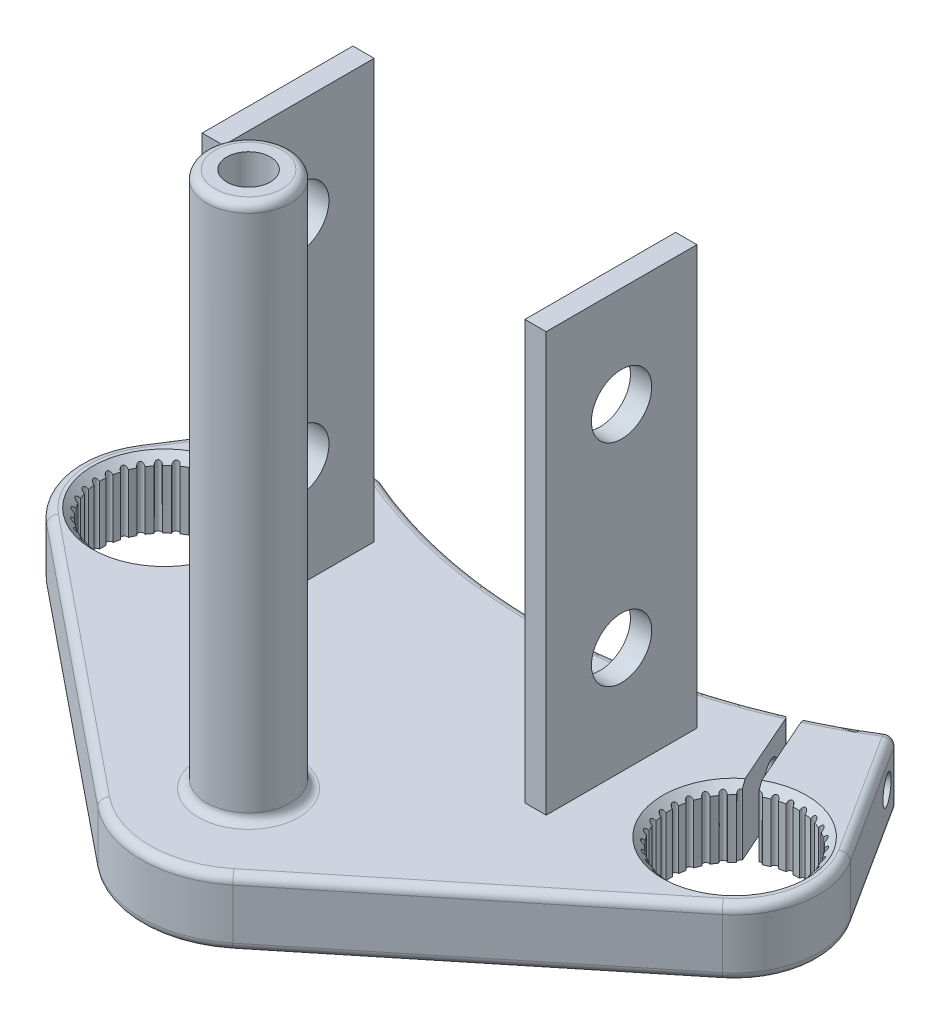
from build123d import *

# Parameters (mm, degrees)
BOSS_EXTRUDE1_DEPTH      = 20
SKETCH2_R                = 12.5
BOSS_EXTRUDE2_DEPTH      = 160
SKETCH3_W                = 6.35
SKETCH3_H                = 45
BOSS_EXTRUDE3_DEPTH      = 125
HOLE1_START              = 155
HOLE1_OUTLINE_R          = 6.5
HOLE1_DEPTH              = 25
SKETCH5_R                = 4
CUT_EXTRUDE1_DEPTH       = 32
CHAMFER1_SIZE            = 2.5
SKETCH6_R                = 0.9
CUT_EXTRUDE2_DEPTH       = 215.909306453
CIRPATTERN1_COUNT        = 32
MIRROR2_COPY_1_SKETCH_R  = 0.9
MIRROR2_COPY_1_DEPTH     = 215.909306453
MIRROR2_COPY_2_SKETCH_R  = 0.9
MIRROR2_COPY_2_DEPTH     = 215.909306453
MIRROR2_COPY_3_SKETCH_R  = 0.9
MIRROR2_COPY_3_DEPTH     = 215.909306453
MIRROR2_COPY_4_SKETCH_R  = 0.9
MIRROR2_COPY_4_DEPTH     = 215.909306453
MIRROR2_COPY_5_SKETCH_R  = 0.9
MIRROR2_COPY_5_DEPTH     = 215.909306453
MIRROR2_COPY_6_SKETCH_R  = 0.9
MIRROR2_COPY_6_DEPTH     = 215.909306453
MIRROR2_COPY_7_SKETCH_R  = 0.9
MIRROR2_COPY_7_DEPTH     = 215.909306453
MIRROR2_COPY_8_SKETCH_R  = 0.9
MIRROR2_COPY_8_DEPTH     = 215.909306453
MIRROR2_COPY_9_SKETCH_R  = 0.9
MIRROR2_COPY_9_DEPTH     = 215.909306453
MIRROR2_COPY_10_SKETCH_R = 0.9
MIRROR2_COPY_10_DEPTH    = 215.909306453
MIRROR2_COPY_11_SKETCH_R = 0.9
MIRROR2_COPY_11_DEPTH    = 215.909306453
MIRROR2_COPY_12_SKETCH_R = 0.9
MIRROR2_COPY_12_DEPTH    = 215.909306453
MIRROR2_COPY_13_SKETCH_R = 0.9
MIRROR2_COPY_13_DEPTH    = 215.909306453
MIRROR2_COPY_14_SKETCH_R = 0.9
MIRROR2_COPY_14_DEPTH    = 215.909306453
MIRROR2_COPY_15_SKETCH_R = 0.9
MIRROR2_COPY_15_DEPTH    = 215.909306453
MIRROR2_COPY_16_SKETCH_R = 0.9
MIRROR2_COPY_16_DEPTH    = 215.909306453
MIRROR2_COPY_17_SKETCH_R = 0.9
MIRROR2_COPY_17_DEPTH    = 215.909306453
MIRROR2_COPY_18_SKETCH_R = 0.9
MIRROR2_COPY_18_DEPTH    = 215.909306453
MIRROR2_COPY_19_SKETCH_R = 0.9
MIRROR2_COPY_19_DEPTH    = 215.909306453
MIRROR2_COPY_20_SKETCH_R = 0.9
MIRROR2_COPY_20_DEPTH    = 215.909306453
MIRROR2_COPY_21_SKETCH_R = 0.9
MIRROR2_COPY_21_DEPTH    = 215.909306453
MIRROR2_COPY_22_SKETCH_R = 0.9
MIRROR2_COPY_22_DEPTH    = 215.909306453
MIRROR2_COPY_23_SKETCH_R = 0.9
MIRROR2_COPY_23_DEPTH    = 215.909306453
MIRROR2_COPY_24_SKETCH_R = 0.9
MIRROR2_COPY_24_DEPTH    = 215.909306453
MIRROR2_COPY_25_SKETCH_R = 0.9
MIRROR2_COPY_25_DEPTH    = 215.909306453
MIRROR2_COPY_26_SKETCH_R = 0.9
MIRROR2_COPY_26_DEPTH    = 215.909306453
MIRROR2_COPY_27_SKETCH_R = 0.9
MIRROR2_COPY_27_DEPTH    = 215.909306453
MIRROR2_COPY_28_SKETCH_R = 0.9
MIRROR2_COPY_28_DEPTH    = 215.909306453
MIRROR2_COPY_29_SKETCH_R = 0.9
MIRROR2_COPY_29_DEPTH    = 215.909306453
MIRROR2_COPY_30_SKETCH_R = 0.9
MIRROR2_COPY_30_DEPTH    = 215.909306453
MIRROR2_COPY_31_SKETCH_R = 0.9
MIRROR2_COPY_31_DEPTH    = 215.909306453
SKETCH7_R                = 9
CUT_EXTRUDE3_DEPTH       = 259.708528077
FILLET1_R                = 2.5


# Read off the part's stored shape, not the designer's step: Hole1
with BuildPart() as part:
    # Sketch1 → Boss-Extrude1 (new body)
    with BuildSketch(Plane(origin=(0, 0, 0), x_dir=(1, 0, 0), z_dir=(0, 1, 0))):
        with BuildLine():
            Line((-81.870927934, 51.465613147), (-106.163647893, 13.465613147))
            ThreePointArc((-106.163647893, 13.465613147), (-109.779474459, -3.990431109), (-100.846768223, -19.417499596))
            Line((-100.846768223, -19.417499596), (-20.155863325, -84.854399482))
            ThreePointArc((-20.155863325, -84.854399482), (0, -92), (20.155863325, -84.854399482))
            Line((20.155863325, -84.854399482), (100.846768223, -19.417499596))
            ThreePointArc((100.846768223, -19.417499596), (109.779474459, -3.990431109), (106.163647893, 13.465613147))
            Line((106.163647893, 13.465613147), (81.870927934, 51.465613147))
            ThreePointArc((81.870927934, 51.465613147), (73.268097521, 46.356821698), (64.347800218, 41.825074))
            Line((64.347800218, 41.825074), (75.519238285, 16.407589858))
            ThreePointArc((75.519238285, 16.407589858), (96.182851462, -15.432770441), (72.613501115, 14.320870979))
            Line((72.613501115, 14.320870979), (61.160054614, 40.379986471))
            ThreePointArc((61.160054614, 40.379986471), (0, 27.532592338), (-61.160054614, 40.379986471))
            Line((-61.160054614, 40.379986471), (-72.613501115, 14.320870979))
            ThreePointArc((-72.613501115, 14.320870979), (-96.182851462, -15.432770441), (-75.519238285, 16.407589858))
            Line((-75.519238285, 16.407589858), (-64.347800218, 41.825074))
            ThreePointArc((-64.347800218, 41.825074), (-73.268097521, 46.356821698), (-81.870927934, 51.465613147))
        make_face()
    extrude(amount=BOSS_EXTRUDE1_DEPTH)

    # Sketch2 → Boss-Extrude2 (add)
    with BuildSketch(Plane(origin=(0, 20, 0), x_dir=(1, 0, 0), z_dir=(0, 1, 0))):
        with Locations(Location((0, -60, 0), (0, 0, 90))):
            Circle(SKETCH2_R)
    extrude(amount=BOSS_EXTRUDE2_DEPTH)

    # Sketch3 → Boss-Extrude3 (add)
    with BuildSketch(Plane(origin=(0, 20, 0), x_dir=(1, 0, 0), z_dir=(0, 1, 0))):
        with Locations((48.175, 0)):
            Rectangle(SKETCH3_W, SKETCH3_H)
        with Locations((-48.175, 0)):
            Rectangle(SKETCH3_W, SKETCH3_H)
    extrude(amount=BOSS_EXTRUDE3_DEPTH)

    # Hole1 outline → Hole1 (cut)
    with BuildSketch(Plane(origin=(0, 0, 0), x_dir=(1, 0, 0), z_dir=(0, 1, 0)).offset(HOLE1_START)):
        with Locations((0, -60)):
            Circle(HOLE1_OUTLINE_R)
    extrude(amount=HOLE1_DEPTH, mode=Mode.SUBTRACT)

    # Sketch5 → Cut-Extrude1 (cut)
    with BuildSketch(Plane(origin=(81.474743965, 0, -52.08534576), x_dir=(-0.5386245258830547, 0, -0.8425459157323444), z_dir=(0.8425459157323443, 0, -0.5386245258830545))):
        with Locations((-9.735547584, 11)):
            Circle(SKETCH5_R)
    cut_extrude1 = extrude(amount=-CUT_EXTRUDE1_DEPTH, mode=Mode.SUBTRACT)

    # Mirror1: Cut-Extrude1 across plane
    add(cut_extrude1.mirror(Plane(origin=(0, 0, 0), x_dir=(0, 0, 1), z_dir=(1, 0, 0))), mode=Mode.SUBTRACT)

    # Chamfer1
    chamfer1_edges = [part.edges().sort_by_distance(p)[0] for p in [
        (-96.182851462, 20, 15.432770441),
        (96.182851462, 20, 15.432770441),
    ]]
    chamfer(chamfer1_edges, length=CHAMFER1_SIZE)

    # Sketch6 → Cut-Extrude2 (cut, through all)
    with BuildSketch(Plane(origin=(0, 20, 0), x_dir=(1, 0, 0), z_dir=(0, 1, 0))):
        with Locations((72.613501115, 14.320870979)):
            Circle(SKETCH6_R)
    cut_extrude2 = extrude(amount=-CUT_EXTRUDE2_DEPTH, mode=Mode.SUBTRACT)

    # CirPattern1: Cut-Extrude2 ×32 about axis
    cirpattern1_axis = Axis((85.1, 0, 0), (0, 1, 0))
    for i in range(1, CIRPATTERN1_COUNT):
        add(cut_extrude2.rotate(cirpattern1_axis, i * 360 / CIRPATTERN1_COUNT), mode=Mode.SUBTRACT)

    # Mirror2: Cut-Extrude2 across plane
    add(cut_extrude2.mirror(Plane(origin=(0, 0, 0), x_dir=(0, 0, 1), z_dir=(1, 0, 0))), mode=Mode.SUBTRACT)

    # Mirror2 copy 1 sketch → Mirror2 copy 1 (cut, through all)
    with BuildSketch(Plane(origin=(-1.635172638, 20, 16.602186404), x_dir=(-0.9807852804032304, 0, -0.19509032201612825), z_dir=(0, 1, 0))):
        with Locations((72.613501115, -14.320870979)):
            Circle(MIRROR2_COPY_1_SKETCH_R)
    extrude(amount=-MIRROR2_COPY_1_DEPTH, mode=Mode.SUBTRACT)

    # Mirror2 copy 2 sketch → Mirror2 copy 2 (cut, through all)
    with BuildSketch(Plane(origin=(-6.477851783, 20, 32.566360094), x_dir=(-0.9238795325112867, 0, -0.3826834323650898), z_dir=(0, 1, 0))):
        with Locations((72.613501115, -14.320870979)):
            Circle(MIRROR2_COPY_2_SKETCH_R)
    extrude(amount=-MIRROR2_COPY_2_DEPTH, mode=Mode.SUBTRACT)

    # Mirror2 copy 3 sketch → Mirror2 copy 3 (cut, through all)
    with BuildSketch(Plane(origin=(-14.341935993, 20, 47.27902683), x_dir=(-0.8314696123025452, 0, -0.5555702330196022), z_dir=(0, 1, 0))):
        with Locations((72.613501115, -14.320870979)):
            Circle(MIRROR2_COPY_3_SKETCH_R)
    extrude(amount=-MIRROR2_COPY_3_DEPTH, mode=Mode.SUBTRACT)

    # Mirror2 copy 4 sketch → Mirror2 copy 4 (cut, through all)
    with BuildSketch(Plane(origin=(-24.925212921, 20, 60.174787079), x_dir=(-0.7071067811865476, 0, -0.7071067811865475), z_dir=(0, 1, 0))):
        with Locations((72.613501115, -14.320870979)):
            Circle(MIRROR2_COPY_4_SKETCH_R)
    extrude(amount=-MIRROR2_COPY_4_DEPTH, mode=Mode.SUBTRACT)

    # Mirror2 copy 5 sketch → Mirror2 copy 5 (cut, through all)
    with BuildSketch(Plane(origin=(-37.82097317, 20, 70.758064007), x_dir=(-0.5555702330196023, 0, -0.8314696123025452), z_dir=(0, 1, 0))):
        with Locations((72.613501115, -14.320870979)):
            Circle(MIRROR2_COPY_5_SKETCH_R)
    extrude(amount=-MIRROR2_COPY_5_DEPTH, mode=Mode.SUBTRACT)

    # Mirror2 copy 6 sketch → Mirror2 copy 6 (cut, through all)
    with BuildSketch(Plane(origin=(-52.533639906, 20, 78.622148217), x_dir=(-0.38268343236508984, 0, -0.9238795325112867), z_dir=(0, 1, 0))):
        with Locations((72.613501115, -14.320870979)):
            Circle(MIRROR2_COPY_6_SKETCH_R)
    extrude(amount=-MIRROR2_COPY_6_DEPTH, mode=Mode.SUBTRACT)

    # Mirror2 copy 7 sketch → Mirror2 copy 7 (cut, through all)
    with BuildSketch(Plane(origin=(-68.497813596, 20, 83.464827362), x_dir=(-0.19509032201612833, 0, -0.9807852804032304), z_dir=(0, 1, 0))):
        with Locations((72.613501115, -14.320870979)):
            Circle(MIRROR2_COPY_7_SKETCH_R)
    extrude(amount=-MIRROR2_COPY_7_DEPTH, mode=Mode.SUBTRACT)

    # Mirror2 copy 8 sketch → Mirror2 copy 8 (cut, through all)
    with BuildSketch(Plane(origin=(-85.1, 20, 85.1), x_dir=(0, 0, -1), z_dir=(0, 1, 0))):
        with Locations((72.613501115, -14.320870979)):
            Circle(MIRROR2_COPY_8_SKETCH_R)
    extrude(amount=-MIRROR2_COPY_8_DEPTH, mode=Mode.SUBTRACT)

    # Mirror2 copy 9 sketch → Mirror2 copy 9 (cut, through all)
    with BuildSketch(Plane(origin=(-101.702186404, 20, 83.464827362), x_dir=(0.1950903220161282, 0, -0.9807852804032304), z_dir=(0, 1, 0))):
        with Locations((72.613501115, -14.320870979)):
            Circle(MIRROR2_COPY_9_SKETCH_R)
    extrude(amount=-MIRROR2_COPY_9_DEPTH, mode=Mode.SUBTRACT)

    # Mirror2 copy 10 sketch → Mirror2 copy 10 (cut, through all)
    with BuildSketch(Plane(origin=(-117.666360094, 20, 78.622148217), x_dir=(0.3826834323650897, 0, -0.9238795325112867), z_dir=(0, 1, 0))):
        with Locations((72.613501115, -14.320870979)):
            Circle(MIRROR2_COPY_10_SKETCH_R)
    extrude(amount=-MIRROR2_COPY_10_DEPTH, mode=Mode.SUBTRACT)

    # Mirror2 copy 11 sketch → Mirror2 copy 11 (cut, through all)
    with BuildSketch(Plane(origin=(-132.37902683, 20, 70.758064007), x_dir=(0.5555702330196023, 0, -0.8314696123025451), z_dir=(0, 1, 0))):
        with Locations((72.613501115, -14.320870979)):
            Circle(MIRROR2_COPY_11_SKETCH_R)
    extrude(amount=-MIRROR2_COPY_11_DEPTH, mode=Mode.SUBTRACT)

    # Mirror2 copy 12 sketch → Mirror2 copy 12 (cut, through all)
    with BuildSketch(Plane(origin=(-145.274787079, 20, 60.174787079), x_dir=(0.7071067811865475, 0, -0.7071067811865476), z_dir=(0, 1, 0))):
        with Locations((72.613501115, -14.320870979)):
            Circle(MIRROR2_COPY_12_SKETCH_R)
    extrude(amount=-MIRROR2_COPY_12_DEPTH, mode=Mode.SUBTRACT)

    # Mirror2 copy 13 sketch → Mirror2 copy 13 (cut, through all)
    with BuildSketch(Plane(origin=(-155.858064007, 20, 47.27902683), x_dir=(0.8314696123025453, 0, -0.5555702330196022), z_dir=(0, 1, 0))):
        with Locations((72.613501115, -14.320870979)):
            Circle(MIRROR2_COPY_13_SKETCH_R)
    extrude(amount=-MIRROR2_COPY_13_DEPTH, mode=Mode.SUBTRACT)

    # Mirror2 copy 14 sketch → Mirror2 copy 14 (cut, through all)
    with BuildSketch(Plane(origin=(-163.722148217, 20, 32.566360094), x_dir=(0.9238795325112867, 0, -0.3826834323650899), z_dir=(0, 1, 0))):
        with Locations((72.613501115, -14.320870979)):
            Circle(MIRROR2_COPY_14_SKETCH_R)
    extrude(amount=-MIRROR2_COPY_14_DEPTH, mode=Mode.SUBTRACT)

    # Mirror2 copy 15 sketch → Mirror2 copy 15 (cut, through all)
    with BuildSketch(Plane(origin=(-168.564827362, 20, 16.602186404), x_dir=(0.9807852804032304, 0, -0.19509032201612816), z_dir=(0, 1, 0))):
        with Locations((72.613501115, -14.320870979)):
            Circle(MIRROR2_COPY_15_SKETCH_R)
    extrude(amount=-MIRROR2_COPY_15_DEPTH, mode=Mode.SUBTRACT)

    # Mirror2 copy 16 sketch → Mirror2 copy 16 (cut, through all)
    with BuildSketch(Plane(origin=(-170.2, 20, 0), x_dir=(1, 0, 0), z_dir=(0, 1, 0))):
        with Locations((72.613501115, -14.320870979)):
            Circle(MIRROR2_COPY_16_SKETCH_R)
    extrude(amount=-MIRROR2_COPY_16_DEPTH, mode=Mode.SUBTRACT)

    # Mirror2 copy 17 sketch → Mirror2 copy 17 (cut, through all)
    with BuildSketch(Plane(origin=(-168.564827362, 20, -16.602186404), x_dir=(0.9807852804032304, 0, 0.19509032201612836), z_dir=(0, 1, 0))):
        with Locations((72.613501115, -14.320870979)):
            Circle(MIRROR2_COPY_17_SKETCH_R)
    extrude(amount=-MIRROR2_COPY_17_DEPTH, mode=Mode.SUBTRACT)

    # Mirror2 copy 18 sketch → Mirror2 copy 18 (cut, through all)
    with BuildSketch(Plane(origin=(-163.722148217, 20, -32.566360094), x_dir=(0.9238795325112868, 0, 0.38268343236508967), z_dir=(0, 1, 0))):
        with Locations((72.613501115, -14.320870979)):
            Circle(MIRROR2_COPY_18_SKETCH_R)
    extrude(amount=-MIRROR2_COPY_18_DEPTH, mode=Mode.SUBTRACT)

    # Mirror2 copy 19 sketch → Mirror2 copy 19 (cut, through all)
    with BuildSketch(Plane(origin=(-155.858064007, 20, -47.27902683), x_dir=(0.8314696123025452, 0, 0.5555702330196023), z_dir=(0, 1, 0))):
        with Locations((72.613501115, -14.320870979)):
            Circle(MIRROR2_COPY_19_SKETCH_R)
    extrude(amount=-MIRROR2_COPY_19_DEPTH, mode=Mode.SUBTRACT)

    # Mirror2 copy 20 sketch → Mirror2 copy 20 (cut, through all)
    with BuildSketch(Plane(origin=(-145.274787079, 20, -60.174787079), x_dir=(0.7071067811865477, 0, 0.7071067811865475), z_dir=(0, 1, 0))):
        with Locations((72.613501115, -14.320870979)):
            Circle(MIRROR2_COPY_20_SKETCH_R)
    extrude(amount=-MIRROR2_COPY_20_DEPTH, mode=Mode.SUBTRACT)

    # Mirror2 copy 21 sketch → Mirror2 copy 21 (cut, through all)
    with BuildSketch(Plane(origin=(-132.37902683, 20, -70.758064007), x_dir=(0.5555702330196022, 0, 0.8314696123025452), z_dir=(0, 1, 0))):
        with Locations((72.613501115, -14.320870979)):
            Circle(MIRROR2_COPY_21_SKETCH_R)
    extrude(amount=-MIRROR2_COPY_21_DEPTH, mode=Mode.SUBTRACT)

    # Mirror2 copy 22 sketch → Mirror2 copy 22 (cut, through all)
    with BuildSketch(Plane(origin=(-117.666360094, 20, -78.622148217), x_dir=(0.3826834323650895, 0, 0.9238795325112868), z_dir=(0, 1, 0))):
        with Locations((72.613501115, -14.320870979)):
            Circle(MIRROR2_COPY_22_SKETCH_R)
    extrude(amount=-MIRROR2_COPY_22_DEPTH, mode=Mode.SUBTRACT)

    # Mirror2 copy 23 sketch → Mirror2 copy 23 (cut, through all)
    with BuildSketch(Plane(origin=(-101.702186404, 20, -83.464827362), x_dir=(0.19509032201612866, 0, 0.9807852804032303), z_dir=(0, 1, 0))):
        with Locations((72.613501115, -14.320870979)):
            Circle(MIRROR2_COPY_23_SKETCH_R)
    extrude(amount=-MIRROR2_COPY_23_DEPTH, mode=Mode.SUBTRACT)

    # Mirror2 copy 24 sketch → Mirror2 copy 24 (cut, through all)
    with BuildSketch(Plane(origin=(-85.1, 20, -85.1), x_dir=(0, 0, 1), z_dir=(0, 1, 0))):
        with Locations((72.613501115, -14.320870979)):
            Circle(MIRROR2_COPY_24_SKETCH_R)
    extrude(amount=-MIRROR2_COPY_24_DEPTH, mode=Mode.SUBTRACT)

    # Mirror2 copy 25 sketch → Mirror2 copy 25 (cut, through all)
    with BuildSketch(Plane(origin=(-68.497813596, 20, -83.464827362), x_dir=(-0.1950903220161283, 0, 0.9807852804032304), z_dir=(0, 1, 0))):
        with Locations((72.613501115, -14.320870979)):
            Circle(MIRROR2_COPY_25_SKETCH_R)
    extrude(amount=-MIRROR2_COPY_25_DEPTH, mode=Mode.SUBTRACT)

    # Mirror2 copy 26 sketch → Mirror2 copy 26 (cut, through all)
    with BuildSketch(Plane(origin=(-52.533639906, 20, -78.622148217), x_dir=(-0.38268343236509, 0, 0.9238795325112866), z_dir=(0, 1, 0))):
        with Locations((72.613501115, -14.320870979)):
            Circle(MIRROR2_COPY_26_SKETCH_R)
    extrude(amount=-MIRROR2_COPY_26_DEPTH, mode=Mode.SUBTRACT)

    # Mirror2 copy 27 sketch → Mirror2 copy 27 (cut, through all)
    with BuildSketch(Plane(origin=(-37.82097317, 20, -70.758064007), x_dir=(-0.5555702330196018, 0, 0.8314696123025455), z_dir=(0, 1, 0))):
        with Locations((72.613501115, -14.320870979)):
            Circle(MIRROR2_COPY_27_SKETCH_R)
    extrude(amount=-MIRROR2_COPY_27_DEPTH, mode=Mode.SUBTRACT)

    # Mirror2 copy 28 sketch → Mirror2 copy 28 (cut, through all)
    with BuildSketch(Plane(origin=(-24.925212921, 20, -60.174787079), x_dir=(-0.7071067811865474, 0, 0.7071067811865477), z_dir=(0, 1, 0))):
        with Locations((72.613501115, -14.320870979)):
            Circle(MIRROR2_COPY_28_SKETCH_R)
    extrude(amount=-MIRROR2_COPY_28_DEPTH, mode=Mode.SUBTRACT)

    # Mirror2 copy 29 sketch → Mirror2 copy 29 (cut, through all)
    with BuildSketch(Plane(origin=(-14.341935993, 20, -47.27902683), x_dir=(-0.8314696123025452, 0, 0.5555702330196022), z_dir=(0, 1, 0))):
        with Locations((72.613501115, -14.320870979)):
            Circle(MIRROR2_COPY_29_SKETCH_R)
    extrude(amount=-MIRROR2_COPY_29_DEPTH, mode=Mode.SUBTRACT)

    # Mirror2 copy 30 sketch → Mirror2 copy 30 (cut, through all)
    with BuildSketch(Plane(origin=(-6.477851783, 20, -32.566360094), x_dir=(-0.9238795325112868, 0, 0.38268343236508956), z_dir=(0, 1, 0))):
        with Locations((72.613501115, -14.320870979)):
            Circle(MIRROR2_COPY_30_SKETCH_R)
    extrude(amount=-MIRROR2_COPY_30_DEPTH, mode=Mode.SUBTRACT)

    # Mirror2 copy 31 sketch → Mirror2 copy 31 (cut, through all)
    with BuildSketch(Plane(origin=(-1.635172638, 20, -16.602186404), x_dir=(-0.9807852804032303, 0, 0.19509032201612872), z_dir=(0, 1, 0))):
        with Locations((72.613501115, -14.320870979)):
            Circle(MIRROR2_COPY_31_SKETCH_R)
    extrude(amount=-MIRROR2_COPY_31_DEPTH, mode=Mode.SUBTRACT)

    # Sketch7 → Cut-Extrude3 (cut, through all)
    with BuildSketch(Plane(origin=(51.35, 0, 0), x_dir=(0, 0, -1), z_dir=(1, 0, 0))):
        with Locations((0, 115)):
            Circle(SKETCH7_R)
        with Locations((0, 52)):
            Circle(SKETCH7_R)
    extrude(amount=-CUT_EXTRUDE3_DEPTH, mode=Mode.SUBTRACT)

    # Fillet1
    fillet1_edges = [part.edges().sort_by_distance(p)[0] for p in [
        (0, 0, -27.532592338),
        (73.268097521, 20, -46.356821698),
        (-73.268097521, 0, -46.356821698),
        (-94.017287914, 0, -32.465613147),
        (-109.779474459, 0, 3.990431109),
        (-60.501315774, 0, 52.135949539),
        (0, 0, 92),
        (60.501315774, 0, 52.135949539),
        (109.779474459, 0, 3.990431109),
        (94.017287914, 0, -32.465613147),
        (73.268097521, 0, -46.356821698),
        (94.017287914, 20, -32.465613147),
        (109.779474459, 20, 3.990431109),
        (61.160054614, 10, -40.379986471),
        (-61.160054614, 10, -40.379986471),
        (-64.347800218, 10, -41.825074),
        (-81.870927934, 10, -51.465613147),
        (81.870927934, 10, -51.465613147),
        (64.347800218, 10, -41.825074),
        (60.501315774, 20, 52.135949539),
        (0, 20, 92),
        (-60.501315774, 20, 52.135949539),
        (-109.779474459, 20, 3.990431109),
        (-94.017287914, 20, -32.465613147),
        (0, 20, 72.5),
        (-73.268097521, 20, -46.356821698),
        (0, 180, 72.5),
        (0, 20, -27.532592338),
    ]]
    fillet(fillet1_edges, radius=FILLET1_R)


solid = part.part
